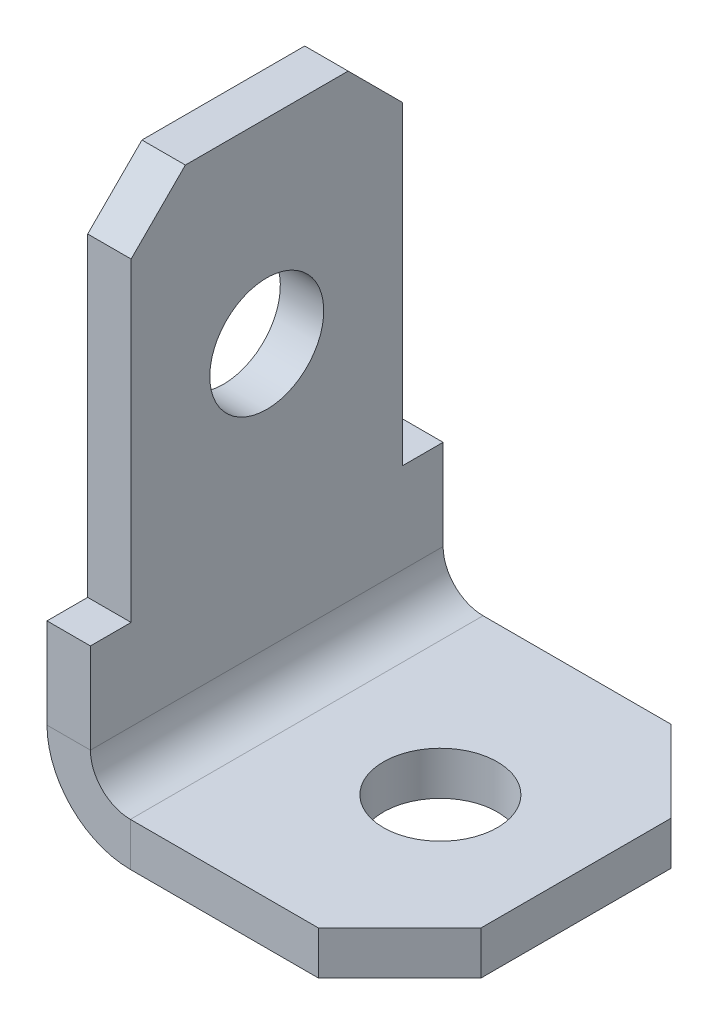
from build123d import *

# Parameters (mm, degrees)
BASE_FLANGE1_DEPTH           = 0.8
EDGE_FLANGE1_STRIP_W         = 4.6732
EDGE_FLANGE1_STRIP_H         = 0.8
EDGE_FLANGE1_STRIP_CUT_DEPTH = 6.5
EDGE_FLANGE1_DEPTH           = 6.5
SKETCH10_W                   = 0.75
SKETCH10_H                   = 6.8
SKETCH10_R                   = 1.05
CUT_EXTRUDE1_DEPTH           = 12.724013818
BREAK_CORNER1_START          = 7.566042559
BREAK_CORNER1_OUTLINE_W      = 4
BREAK_CORNER1_OUTLINE_H      = 4.566042559
BREAK_CORNER1_DEPTH          = 0.707106781
BREAK_CORNER1_START_2        = 4.030508653
BREAK_CORNER1_2_OUTLINE_W    = 4
BREAK_CORNER1_2_OUTLINE_H    = 1.433957441
BREAK_CORNER1_2_DEPTH        = 1.414213562
SKETCH11_R                   = 1.05
CUT_EXTRUDE2_DEPTH           = 11.2842112


# Read off the part's stored shape, not the designer's step: Break-Corner1
# Sheet-metal steps are written as plain solids
with BuildPart() as part:
    # Sketch1 → Base-Flange1 (new body)
    with BuildSketch(Plane(origin=(0, 0, 0), x_dir=(1, 0, 0), z_dir=(0, 1, 0))):
        Polygon((1.75, 3.25), (3.25, 1.75), (3.25, -1.75), (1.75, -3.25), (-3.25, -3.25), (-3.25, 3.25), align=None)
    extrude(amount=-BASE_FLANGE1_DEPTH)

    # Edge-Flange1 strip (across the edge) → Edge-Flange1 strip cut (cut)
    with BuildSketch(Plane(origin=(-3.25, 0, -3.25), x_dir=(1, 0, 0), z_dir=(0, 0, 1))):
        with Locations((-0.8, -0.4)):
            Rectangle(EDGE_FLANGE1_STRIP_W, EDGE_FLANGE1_STRIP_H)
    extrude(amount=EDGE_FLANGE1_STRIP_CUT_DEPTH, mode=Mode.SUBTRACT)

    # Edge-Flange1 section (across the edge) → Edge-Flange1 (add)
    with BuildSketch(Plane(origin=(-3.25, 0, -3.25), x_dir=(1, 0, 0), z_dir=(0, 0, 1))):
        with BuildLine():
            Line((0, 0.7366), (0, 9.2))
            Line((0, 9.2), (0.8, 9.2))
            Line((0.8, 9.2), (0.8, 0.7366))
            ThreePointArc((0.8, 0.7366), (1.015745145, 0.215745145), (1.5366, 0))
            Line((1.5366, 0), (1.5366, -0.8))
            ThreePointArc((1.5366, -0.8), (0.45005972, -0.34994028), (0, 0.7366))
        make_face()
    extrude(amount=EDGE_FLANGE1_DEPTH)

    # Sketch10 → Cut-Extrude1 (cut, through all)
    with BuildSketch(Plane.ZY.offset(3.25)):
        with Locations((-2.875, 5.8)):
            Rectangle(SKETCH10_W, SKETCH10_H)
        with Locations((2.875, 5.8)):
            Rectangle(SKETCH10_W, SKETCH10_H)
        with Locations(Location((0, 5.6, 0), (0, 0, 270))):
            Circle(SKETCH10_R)
    extrude(amount=-CUT_EXTRUDE1_DEPTH, mode=Mode.SUBTRACT)

    # Break-Corner1 outline → Break-Corner1 (cut)
    with BuildSketch(Plane(origin=(0, 0, 0), x_dir=(1, 0, 0), z_dir=(0, 0.707106781186547, -0.707106781186548)).offset(BREAK_CORNER1_START)):
        with Locations((-3, -5.283021279)):
            Rectangle(BREAK_CORNER1_OUTLINE_W, BREAK_CORNER1_OUTLINE_H)
    extrude(amount=BREAK_CORNER1_DEPTH, mode=Mode.SUBTRACT)

    # Break-Corner1 2 outline → Break-Corner1 2 (cut)
    with BuildSketch(Plane(origin=(0, 0, 0), x_dir=(1, 0, 0), z_dir=(0, 0.707106781186547, -0.707106781186548)).offset(BREAK_CORNER1_START_2)):
        with Locations((-3, -8.283021279)):
            Rectangle(BREAK_CORNER1_2_OUTLINE_W, BREAK_CORNER1_2_OUTLINE_H)
    extrude(amount=BREAK_CORNER1_2_DEPTH, mode=Mode.SUBTRACT)

    # Sketch11 → Cut-Extrude2 (cut, through all)
    with BuildSketch(Plane(origin=(0, 0, 0), x_dir=(1, 0, 0), z_dir=(0, 1, 0))):
        with Locations(Location((0.75, 0, 0), (0, 0, 270))):
            Circle(SKETCH11_R)
    extrude(amount=-CUT_EXTRUDE2_DEPTH, mode=Mode.SUBTRACT)


solid = part.part
